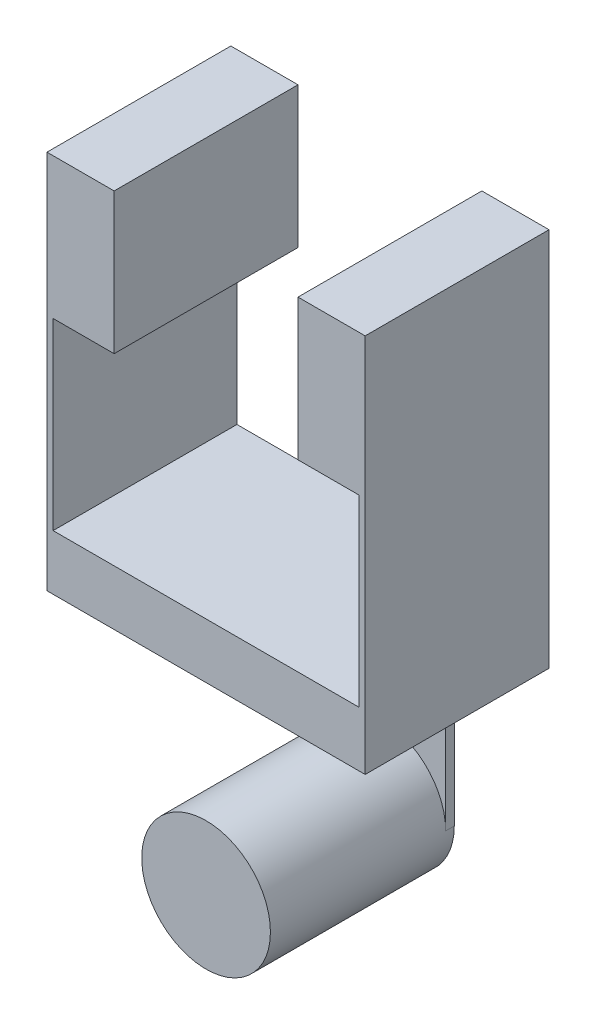
from build123d import *

# Parameters (mm, degrees)
SKETCH1_R           = 13.335
FEATUREA_DEPTH      = 38.1
SKETCH2_W           = 26.67
SKETCH2_H           = 38.1
FEATUREB_DEPTH      = 1.778
FEATUREC_DEPTH      = 11.43
SKETCH4_W           = 1.27
SKETCH4_H           = 38.1
FEATURED_DEPTH      = 38.0746
SKETCH7_W           = 13.9192
SKETCH7_H           = 38.1
BOSS_EXTRUDE5_DEPTH = 29.21


with BuildPart() as part:
    # Sketch1 → FeatureA (new body)
    with BuildSketch(Plane.XY):
        Circle(SKETCH1_R)
    extrude(amount=-FEATUREA_DEPTH)

    # Sketch2 → FeatureB (add)
    with BuildSketch(Plane(origin=(0, 0, -38.1), x_dir=(-1, 0, 0), z_dir=(0, 0, -1))):
        with Locations((0, 19.05)):
            Rectangle(SKETCH2_W, SKETCH2_H)
    extrude(amount=-FEATUREB_DEPTH)

    # Sketch3 → FeatureC (add)
    with BuildSketch(Plane(origin=(0, 38.1, 0), x_dir=(1, 0, 0), z_dir=(0, 1, 0))):
        Polygon((0, 38.1), (-32.9692, 38.1), (-32.9692, 0), (32.9692, 0), (32.9692, 38.1), align=None)
    extrude(amount=FEATUREC_DEPTH)

    # Sketch4 → FeatureD (add)
    with BuildSketch(Plane(origin=(0, 49.53, 0), x_dir=(1, 0, 0), z_dir=(0, 1, 0))):
        with Locations((32.3342, 19.05)):
            Rectangle(SKETCH4_W, SKETCH4_H)
        with Locations((-32.3342, 19.05)):
            Rectangle(SKETCH4_W, SKETCH4_H)
    extrude(amount=FEATURED_DEPTH)

    # Sketch7 → Boss-Extrude5 (add)
    with BuildSketch(Plane(origin=(0, 87.6046, 0), x_dir=(1, 0, 0), z_dir=(0, 1, 0))):
        with Locations((26.0096, 19.05)):
            Rectangle(SKETCH7_W, SKETCH7_H)
        with Locations((-26.0096, 19.05)):
            Rectangle(SKETCH7_W, SKETCH7_H)
    extrude(amount=BOSS_EXTRUDE5_DEPTH)


solid = part.part
